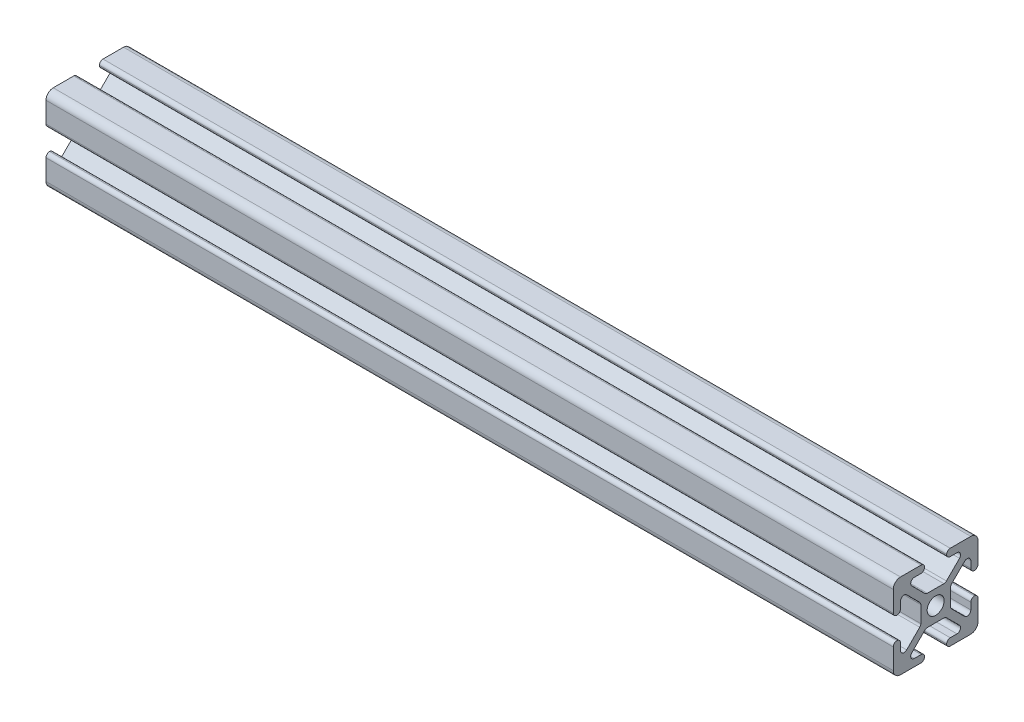
from build123d import *

# Parameters (mm, degrees)
SKETCH1_R           = 2.5
BOSS_EXTRUDE1_DEPTH = 250
FILLET1_R           = 1.065
FILLET2_R           = 2.13


with BuildPart() as part:
    # Sketch1 → Boss-Extrude1 (new body)
    with BuildSketch(Plane.YZ):
        Polygon((-12.5, -3.25), (-12.5, -12.5), (-3.25, -12.5), (-3.25, -10.37), (-8.863862556, -10.37), (-2.873862556, -4.38), (2.873862556, -4.38), (8.863862556, -10.37), (3.25, -10.37), (3.25, -12.5), (12.5, -12.5), (12.5, -3.25), (10.37, -3.25), (10.37, -8.863862556), (4.38, -2.873862556), (4.38, 2.873862556), (10.37, 8.863862556), (10.37, 3.25), (12.5, 3.25), (12.5, 12.5), (3.25, 12.5), (3.25, 10.37), (8.863862556, 10.37), (2.873862556, 4.38), (-2.873862556, 4.38), (-8.863862556, 10.37), (-3.25, 10.37), (-3.25, 12.5), (-12.5, 12.5), (-12.5, 3.25), (-10.37, 3.25), (-10.37, 8.863862556), (-4.38, 2.873862556), (-4.38, -2.873862556), (-10.37, -8.863862556), (-10.37, -3.25), align=None)
        with Locations(Location((0, 0, 0), (0, 0, 270))):
            Circle(SKETCH1_R, mode=Mode.SUBTRACT)
    extrude(amount=BOSS_EXTRUDE1_DEPTH)

    # Fillet1
    fillet1_edges = [part.edges().sort_by_distance(p)[0] for p in [
        (125, -10.37, -8.863862556),
        (125, 2.873862556, -4.38),
        (125, -2.873862556, -4.38),
        (125, -4.38, 2.873862556),
        (125, -4.38, -2.873862556),
        (125, -2.873862556, 4.38),
        (125, 2.873862556, 4.38),
        (125, 4.38, 2.873862556),
        (125, 4.38, -2.873862556),
        (125, -8.863862556, -10.37),
        (125, 8.863862556, -10.37),
        (125, 10.37, -8.863862556),
        (125, -10.37, 8.863862556),
        (125, -8.863862556, 10.37),
        (125, 10.37, 8.863862556),
        (125, 8.863862556, 10.37),
        (125, 12.5, 3.25),
        (125, -3.25, -12.5),
        (125, -10.37, 3.25),
        (125, 10.37, 3.25),
        (125, -10.37, -3.25),
        (125, -12.5, -3.25),
        (125, -12.5, 3.25),
        (125, 3.25, -10.37),
        (125, -3.25, -10.37),
        (125, 3.25, -12.5),
        (125, 10.37, -3.25),
        (125, 12.5, -3.25),
        (125, 3.25, 12.5),
        (125, 3.25, 10.37),
        (125, -3.25, 10.37),
        (125, -3.25, 12.5),
    ]]
    fillet(fillet1_edges, radius=FILLET1_R - 0.0001)  # a hair under: the kernel refuses the full size

    # Fillet2
    fillet2_edges = [part.edges().sort_by_distance(p)[0] for p in [
        (125, -12.5, 12.5),
        (125, 12.5, 12.5),
        (125, 12.5, -12.5),
        (125, -12.5, -12.5),
    ]]
    fillet(fillet2_edges, radius=FILLET2_R)


solid = part.part
